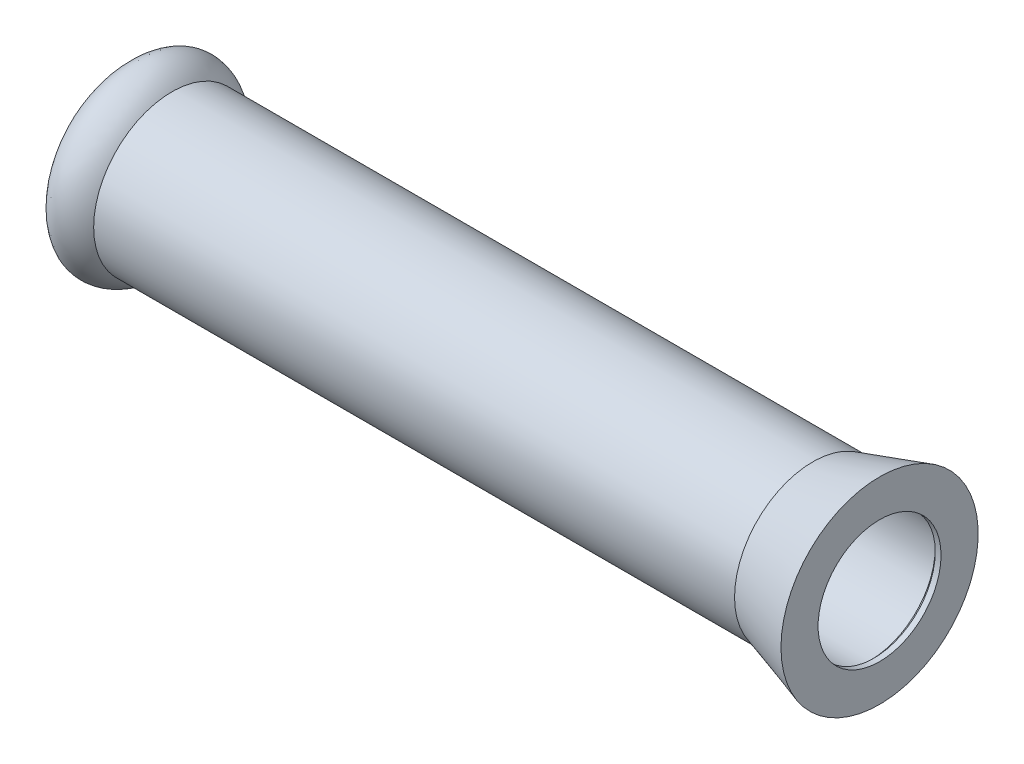
from build123d import *
from build123d.topology import SkipClean

# Parameters (mm, degrees)
SKETCH1_R           = 13.5
SKETCH1_R_2         = 11.2
BOSS_EXTRUDE1_DEPTH = 60
CIRPATTERN1_COUNT   = 8
LPATTERN1_COUNT     = 3
LPATTERN1_PITCH     = 20
FILLET1_R           = 3
BOSS_EXTRUDE2_START = -1
SKETCH4_R           = 11.2
SKETCH4_R_2         = 10.6
BOSS_EXTRUDE2_DEPTH = 1
CHAMFER1_SIZE       = 0.6


# Some blends are built 0.0001 mm under size
with BuildPart() as part:
    # Sketch1 → Boss-Extrude1 (new body)
    with BuildSketch(Plane(origin=(0, 0, 0), x_dir=(0, 0, -1), z_dir=(1, 0, 0))):
        Circle(SKETCH1_R)
        Circle(SKETCH1_R_2, mode=Mode.SUBTRACT)
    extrude(amount=BOSS_EXTRUDE1_DEPTH)

    # Sketch2 → Cut-Revolve1 (revolve, cut)
    with BuildSketch(Plane.XY):
        with BuildLine():
            Line((8, 12.6), (8, 9.6))
            Line((8, 9.6), (11, 9.6))
            ThreePointArc((11, 9.6), (10.121320344, 11.721320344), (8, 12.6))
        make_face()
    cut_revolve1 = revolve(axis=Axis((8, 12.6, 0), (0, -1, 0)), mode=Mode.SUBTRACT)

    # CirPattern1: Cut-Revolve1 ×8 about axis
    cirpattern1_axis = Axis((0, 0, 0), (1, 0, 0))
    for i in range(1, CIRPATTERN1_COUNT):
        add(cut_revolve1.rotate(cirpattern1_axis, i * 360 / CIRPATTERN1_COUNT), mode=Mode.SUBTRACT)

    # LPattern1: Cut-Revolve1 ×3
    with Locations(*[(i * LPATTERN1_PITCH, 0, 0) for i in range(1, LPATTERN1_COUNT)]):
        add(cut_revolve1, mode=Mode.SUBTRACT)

    # LPattern1 copy 1 sketch → LPattern1 copy 1 (revolve, cut)
    with BuildSketch(Plane(origin=(20, 0, 0), x_dir=(1, 0, 0), z_dir=(0, -0.7071067811865475, 0.7071067811865476))):
        with BuildLine():
            Line((8, 12.6), (8, 9.6))
            Line((8, 9.6), (11, 9.6))
            ThreePointArc((11, 9.6), (10.121320344, 11.721320344), (8, 12.6))
        make_face()
    revolve(axis=Axis((28, 8.909545443, 8.909545443), (0, -0.7071067811865476, -0.7071067811865475)), mode=Mode.SUBTRACT)

    # LPattern1 copy 2 sketch → LPattern1 copy 2 (revolve, cut)
    with BuildSketch(Plane(origin=(40, 0, 0), x_dir=(1, 0, 0), z_dir=(0, -0.7071067811865475, 0.7071067811865476))):
        with BuildLine():
            Line((8, 12.6), (8, 9.6))
            Line((8, 9.6), (11, 9.6))
            ThreePointArc((11, 9.6), (10.121320344, 11.721320344), (8, 12.6))
        make_face()
    revolve(axis=Axis((48, 8.909545443, 8.909545443), (0, -0.7071067811865476, -0.7071067811865475)), mode=Mode.SUBTRACT)

    # LPattern1 copy 3 sketch → LPattern1 copy 3 (revolve, cut)
    with BuildSketch(Plane(origin=(20, 0, 0), x_dir=(1, 0, 0), z_dir=(0, -1, 0))):
        with BuildLine():
            Line((8, 12.6), (8, 9.6))
            Line((8, 9.6), (11, 9.6))
            ThreePointArc((11, 9.6), (10.121320344, 11.721320344), (8, 12.6))
        make_face()
    revolve(axis=Axis((28, 0, 12.6), (0, 0, -1)), mode=Mode.SUBTRACT)

    # LPattern1 copy 4 sketch → LPattern1 copy 4 (revolve, cut)
    with BuildSketch(Plane(origin=(40, 0, 0), x_dir=(1, 0, 0), z_dir=(0, -1, 0))):
        with BuildLine():
            Line((8, 12.6), (8, 9.6))
            Line((8, 9.6), (11, 9.6))
            ThreePointArc((11, 9.6), (10.121320344, 11.721320344), (8, 12.6))
        make_face()
    revolve(axis=Axis((48, 0, 12.6), (0, 0, -1)), mode=Mode.SUBTRACT)

    # LPattern1 copy 5 sketch → LPattern1 copy 5 (revolve, cut)
    with BuildSketch(Plane(origin=(20, 0, 0), x_dir=(1, 0, 0), z_dir=(0, -0.7071067811865476, -0.7071067811865475))):
        with BuildLine():
            Line((8, 12.6), (8, 9.6))
            Line((8, 9.6), (11, 9.6))
            ThreePointArc((11, 9.6), (10.121320344, 11.721320344), (8, 12.6))
        make_face()
    revolve(axis=Axis((28, -8.909545443, 8.909545443), (0, 0.7071067811865475, -0.7071067811865476)), mode=Mode.SUBTRACT)

    # LPattern1 copy 6 sketch → LPattern1 copy 6 (revolve, cut)
    with BuildSketch(Plane(origin=(40, 0, 0), x_dir=(1, 0, 0), z_dir=(0, -0.7071067811865476, -0.7071067811865475))):
        with BuildLine():
            Line((8, 12.6), (8, 9.6))
            Line((8, 9.6), (11, 9.6))
            ThreePointArc((11, 9.6), (10.121320344, 11.721320344), (8, 12.6))
        make_face()
    revolve(axis=Axis((48, -8.909545443, 8.909545443), (0, 0.7071067811865475, -0.7071067811865476)), mode=Mode.SUBTRACT)

    # LPattern1 copy 7 sketch → LPattern1 copy 7 (revolve, cut)
    with BuildSketch(Plane(origin=(20, 0, 0), x_dir=(1, 0, 0), z_dir=(0, 0, -1))):
        with BuildLine():
            Line((8, 12.6), (8, 9.6))
            Line((8, 9.6), (11, 9.6))
            ThreePointArc((11, 9.6), (10.121320344, 11.721320344), (8, 12.6))
        make_face()
    revolve(axis=Axis((28, -12.6, 0), (0, 1, 0)), mode=Mode.SUBTRACT)

    # LPattern1 copy 8 sketch → LPattern1 copy 8 (revolve, cut)
    with BuildSketch(Plane(origin=(40, 0, 0), x_dir=(1, 0, 0), z_dir=(0, 0, -1))):
        with BuildLine():
            Line((8, 12.6), (8, 9.6))
            Line((8, 9.6), (11, 9.6))
            ThreePointArc((11, 9.6), (10.121320344, 11.721320344), (8, 12.6))
        make_face()
    revolve(axis=Axis((48, -12.6, 0), (0, 1, 0)), mode=Mode.SUBTRACT)

    # LPattern1 copy 9 sketch → LPattern1 copy 9 (revolve, cut)
    with BuildSketch(Plane(origin=(20, 0, 0), x_dir=(1, 0, 0), z_dir=(0, 0.7071067811865475, -0.7071067811865477))):
        with BuildLine():
            Line((8, 12.6), (8, 9.6))
            Line((8, 9.6), (11, 9.6))
            ThreePointArc((11, 9.6), (10.121320344, 11.721320344), (8, 12.6))
        make_face()
    revolve(axis=Axis((28, -8.909545443, -8.909545443), (0, 0.7071067811865477, 0.7071067811865475)), mode=Mode.SUBTRACT)

    # LPattern1 copy 10 sketch → LPattern1 copy 10 (revolve, cut)
    with BuildSketch(Plane(origin=(40, 0, 0), x_dir=(1, 0, 0), z_dir=(0, 0.7071067811865475, -0.7071067811865477))):
        with BuildLine():
            Line((8, 12.6), (8, 9.6))
            Line((8, 9.6), (11, 9.6))
            ThreePointArc((11, 9.6), (10.121320344, 11.721320344), (8, 12.6))
        make_face()
    revolve(axis=Axis((48, -8.909545443, -8.909545443), (0, 0.7071067811865477, 0.7071067811865475)), mode=Mode.SUBTRACT)

    # LPattern1 copy 11 sketch → LPattern1 copy 11 (revolve, cut)
    with BuildSketch(Plane(origin=(20, 0, 0), x_dir=(1, 0, 0), z_dir=(0, 1, 0))):
        with BuildLine():
            Line((8, 12.6), (8, 9.6))
            Line((8, 9.6), (11, 9.6))
            ThreePointArc((11, 9.6), (10.121320344, 11.721320344), (8, 12.6))
        make_face()
    revolve(axis=Axis((28, 0, -12.6), (0, 0, 1)), mode=Mode.SUBTRACT)

    # LPattern1 copy 12 sketch → LPattern1 copy 12 (revolve, cut)
    with BuildSketch(Plane(origin=(40, 0, 0), x_dir=(1, 0, 0), z_dir=(0, 1, 0))):
        with BuildLine():
            Line((8, 12.6), (8, 9.6))
            Line((8, 9.6), (11, 9.6))
            ThreePointArc((11, 9.6), (10.121320344, 11.721320344), (8, 12.6))
        make_face()
    revolve(axis=Axis((48, 0, -12.6), (0, 0, 1)), mode=Mode.SUBTRACT)

    # LPattern1 copy 13 sketch → LPattern1 copy 13 (revolve, cut)
    with BuildSketch(Plane(origin=(20, 0, 0), x_dir=(1, 0, 0), z_dir=(0, 0.7071067811865477, 0.7071067811865474))):
        with BuildLine():
            Line((8, 12.6), (8, 9.6))
            Line((8, 9.6), (11, 9.6))
            ThreePointArc((11, 9.6), (10.121320344, 11.721320344), (8, 12.6))
        make_face()
    revolve(axis=Axis((28, 8.909545443, -8.909545443), (0, -0.7071067811865474, 0.7071067811865477)), mode=Mode.SUBTRACT)

    # LPattern1 copy 14 sketch → LPattern1 copy 14 (revolve, cut)
    with BuildSketch(Plane(origin=(40, 0, 0), x_dir=(1, 0, 0), z_dir=(0, 0.7071067811865477, 0.7071067811865474))):
        with BuildLine():
            Line((8, 12.6), (8, 9.6))
            Line((8, 9.6), (11, 9.6))
            ThreePointArc((11, 9.6), (10.121320344, 11.721320344), (8, 12.6))
        make_face()
    revolve(axis=Axis((48, 8.909545443, -8.909545443), (0, -0.7071067811865474, 0.7071067811865477)), mode=Mode.SUBTRACT)

    # Fillet1
    # the kernel refuses this fillet: 3 mm, written as the material it takes off along each edge
    with BuildSketch(Plane(origin=(0, 0, 0), x_dir=(0, 0, -1), z_dir=(0, -1, 0))) as fillet1_piece_1:
        with BuildLine():
            CenterArc((14.2, 2.917190429), FILLET1_R, 180, 76.506601178)
            Line((11.2, 2.917190429), (11.14, 2.917190429))
            Line((11.14, 2.917190429), (11.14, 0))
            Line((11.14, 0), (11.2, -0.06))
            ThreePointArc((11.2, -0.06), (12.35, -0.06), (13.486, -0.058343809))
            Line((13.486, -0.058343809), (13.5, 0))
        make_face()
    revolve(axis=Axis((0, 0, 0), (1, 0, 0)), mode=Mode.SUBTRACT)

    # Sketch3 → Revolve1 (revolve)
    with SkipClean():  # the faces are left unmerged after this step: merging them gives an invalid solid
        with BuildSketch(Plane.XY, mode=Mode.PRIVATE) as revolve1_sk:
            with BuildLine():
                Line((8, 13.5), (118.5, 13.5))
                Line((118.5, 13.5), (130, 17))
                Line((130, 17), (130, 11.2))
                Line((130, 11.2), (60, 11.2))
                Line((60, 11.2), (60, 13))
                Line((60, 13), (0, 13))
                Line((0, 13), (0, 13.5))
                add(Edge.make_bspline(
                    [(0, 13.5), (0.688291724, 14.482982453), (1.609903955, 15.440332136), (4.131776845, 16.282273078), (6.457309737, 15.338506663), (8, 13.5)],
                    knots=[0, 0, 0, 0, 0.338781374, 0.438781374, 1, 1, 1, 1], degree=3))
            make_face()
        revolve(revolve1_sk.sketch.rotate(Axis((0, 0, 0), (1, 0, 0)), 90), axis=Axis((0, 0, 0), (1, 0, 0)))
    add(part.part.scale(1), mode=Mode.REPLACE)  # the faces are merged on a copy

    # Sketch4 → Boss-Extrude2 (add)
    with SkipClean():  # the faces are left unmerged after this step: merging them gives an invalid solid
        with BuildSketch(Plane(origin=(130, 0, 0), x_dir=(0, 0, -1), z_dir=(1, 0, 0)).offset(BOSS_EXTRUDE2_START)):
            with Locations(Location((0, 0, 0), (0, 0, 180))):
                Circle(SKETCH4_R)
            Circle(SKETCH4_R_2, mode=Mode.SUBTRACT)
        extrude(amount=BOSS_EXTRUDE2_DEPTH)

    # Chamfer1
    chamfer1_edges = [part.edges().sort_by_distance(p)[0] for p in [
        (129, 0, -11.2),
    ]]
    chamfer(chamfer1_edges, length=CHAMFER1_SIZE - 0.0001)  # a hair under: the kernel refuses the full size


solid = part.part
